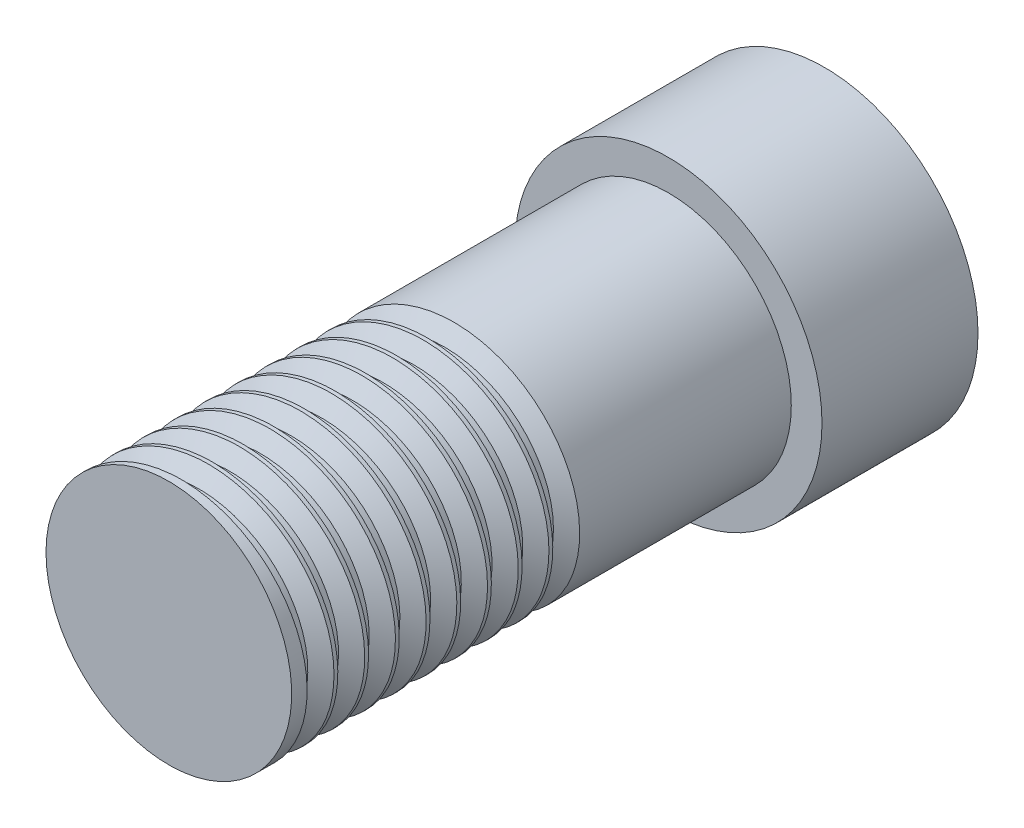
from build123d import *

# Parameters (mm, degrees)
SKETCH1_R           = 5
SKETCH1_R_2         = 2.5525
BOSS_EXTRUDE1_DEPTH = 5.08
SKETCH2_R           = 4
BOSS_EXTRUDE2_DEPTH = 1.27
THREAD1_PITCH       = 1.27
SKETCH4_R           = 4
BOSS_EXTRUDE3_DEPTH = 15
THREAD2_PITCH       = 1


with BuildPart() as part:
    # Sketch1 → Boss-Extrude1 (new body)
    with BuildSketch(Plane.XY):
        Circle(SKETCH1_R)
        Circle(SKETCH1_R_2, mode=Mode.SUBTRACT)
    extrude(amount=BOSS_EXTRUDE1_DEPTH)

    # Sketch2 → Boss-Extrude2 (add)
    with BuildSketch(Plane.XY.offset(5.08)):
        Circle(SKETCH2_R)
    extrude(amount=BOSS_EXTRUDE2_DEPTH)

    # Thread1: the profile of Thread Profile1 profile screwed along a right-hand helix of 4.094488 turns, 8 arcs to a turn; built about Z, then put on its axis
    thread1_z = Axis((0, 0, 0), (0, 0, 1))
    thread1_corners = [(2.5528, 0, -0.000173), (2.5528, 0, 1.111423), (1.865092, 0, 0.714375), (1.865092, 0, 0.396875)]
    with BuildLine(mode=Mode.PRIVATE) as thread1_profile:
        Line(thread1_corners[0], thread1_corners[1])
        Line(thread1_corners[1], thread1_corners[2])
        Line(thread1_corners[2], thread1_corners[3])
        Line(thread1_corners[3], thread1_corners[0])
    thread1_cap = Face(thread1_profile.wire())
    thread1_turn_angles = [0, 22.5, 45, 67.5, 90, 112.5, 135, 157.5, 180, 202.5, 225, 247.5, 270, 292.5, 315, 337.5, 360]
    thread1_turn_weights = [1, 0.9238795325112867, 1, 0.9238795325112867, 1, 0.9238795325112867, 1, 0.9238795325112867, 1, 0.9238795325112867, 1, 0.9238795325112867, 1, 0.9238795325112867, 1, 0.9238795325112867, 1]
    thread1_turn_rails = [Edge.make_bspline([Vector(p[0], p[1], 0).rotate(thread1_z, thread1_turn_angles[k]) / thread1_turn_weights[k] + Vector(0, 0, p[2] + THREAD1_PITCH * thread1_turn_angles[k] / 360) for k in range(17)], [0, 0, 0, 1, 1, 2, 2, 3, 3, 4, 4, 5, 5, 6, 6, 7, 7, 8, 8, 8], 2, thread1_turn_weights) for p in thread1_corners]
    thread1_turn_sides = [Face.make_surface_from_curves(thread1_turn_rails[p[0]], thread1_turn_rails[p[1]]) for p in [(0, 1), (1, 2), (2, 3), (3, 0)]]
    thread1_last_angles = [1440, 1457.007874, 1474.015748]
    thread1_last_weights = [1, 0.9562645670201275, 1]
    thread1_last_rails = [Edge.make_bspline([Vector(p[0], p[1], 0).rotate(thread1_z, thread1_last_angles[k]) / thread1_last_weights[k] + Vector(0, 0, p[2] + THREAD1_PITCH * thread1_last_angles[k] / 360) for k in range(3)], [0, 0, 0, 1, 1, 1], 2, thread1_last_weights) for p in thread1_corners]
    thread1_last_sides = [Face.make_surface_from_curves(thread1_last_rails[p[0]], thread1_last_rails[p[1]]) for p in [(0, 1), (1, 2), (2, 3), (3, 0)]]
    thread1 = Plane(origin=(0, 0, 0), x_dir=(1, 0, 0), z_dir=(0, 0, 1)) * Solid(Shell([*[p.moved(Location((0, 0, THREAD1_PITCH * i))) for i in range(4) for p in thread1_turn_sides], *thread1_last_sides, thread1_cap, thread1_cap.rotate(thread1_z, 1474.015748).moved(Location((0, 0, THREAD1_PITCH * 1474.015748 / 360)))]))
    add(thread1)

    # Sketch4 → Boss-Extrude3 (add)
    with BuildSketch(Plane.XY.offset(6.35)):
        Circle(SKETCH4_R)
    extrude(amount=BOSS_EXTRUDE3_DEPTH)

    # Thread2: the profile of Thread Profile3 profile screwed along a right-hand helix of 9 turns, 8 arcs to a turn; built about Z, then put on its axis
    thread2_z = Axis((0, 0, 0), (0, 0, 1))
    thread2_corners = [(4.0003, 0, -0.000173), (4.0003, 0, 0.875173), (3.458734, 0, 0.5625), (3.458734, 0, 0.3125)]
    with BuildLine(mode=Mode.PRIVATE) as thread2_profile:
        Line(thread2_corners[0], thread2_corners[1])
        Line(thread2_corners[1], thread2_corners[2])
        Line(thread2_corners[2], thread2_corners[3])
        Line(thread2_corners[3], thread2_corners[0])
    thread2_cap = Face(thread2_profile.wire())
    thread2_turn_angles = [0, 22.5, 45, 67.5, 90, 112.5, 135, 157.5, 180, 202.5, 225, 247.5, 270, 292.5, 315, 337.5, 360]
    thread2_turn_weights = [1, 0.9238795325112867, 1, 0.9238795325112867, 1, 0.9238795325112867, 1, 0.9238795325112867, 1, 0.9238795325112867, 1, 0.9238795325112867, 1, 0.9238795325112867, 1, 0.9238795325112867, 1]
    thread2_turn_rails = [Edge.make_bspline([Vector(p[0], p[1], 0).rotate(thread2_z, thread2_turn_angles[k]) / thread2_turn_weights[k] + Vector(0, 0, p[2] + THREAD2_PITCH * thread2_turn_angles[k] / 360) for k in range(17)], [0, 0, 0, 1, 1, 2, 2, 3, 3, 4, 4, 5, 5, 6, 6, 7, 7, 8, 8, 8], 2, thread2_turn_weights) for p in thread2_corners]
    thread2_turn_sides = [Face.make_surface_from_curves(thread2_turn_rails[p[0]], thread2_turn_rails[p[1]]) for p in [(0, 1), (1, 2), (2, 3), (3, 0)]]
    thread2 = Plane(origin=(0, 0, 21.35), x_dir=(-1, 0, 0), z_dir=(0, 0, -1)) * Solid(Shell([*[p.moved(Location((0, 0, THREAD2_PITCH * i))) for i in range(9) for p in thread2_turn_sides], thread2_cap, thread2_cap.rotate(thread2_z, 3240).moved(Location((0, 0, THREAD2_PITCH * 3240 / 360)))]))
    add(thread2, mode=Mode.SUBTRACT)


solid = part.part
